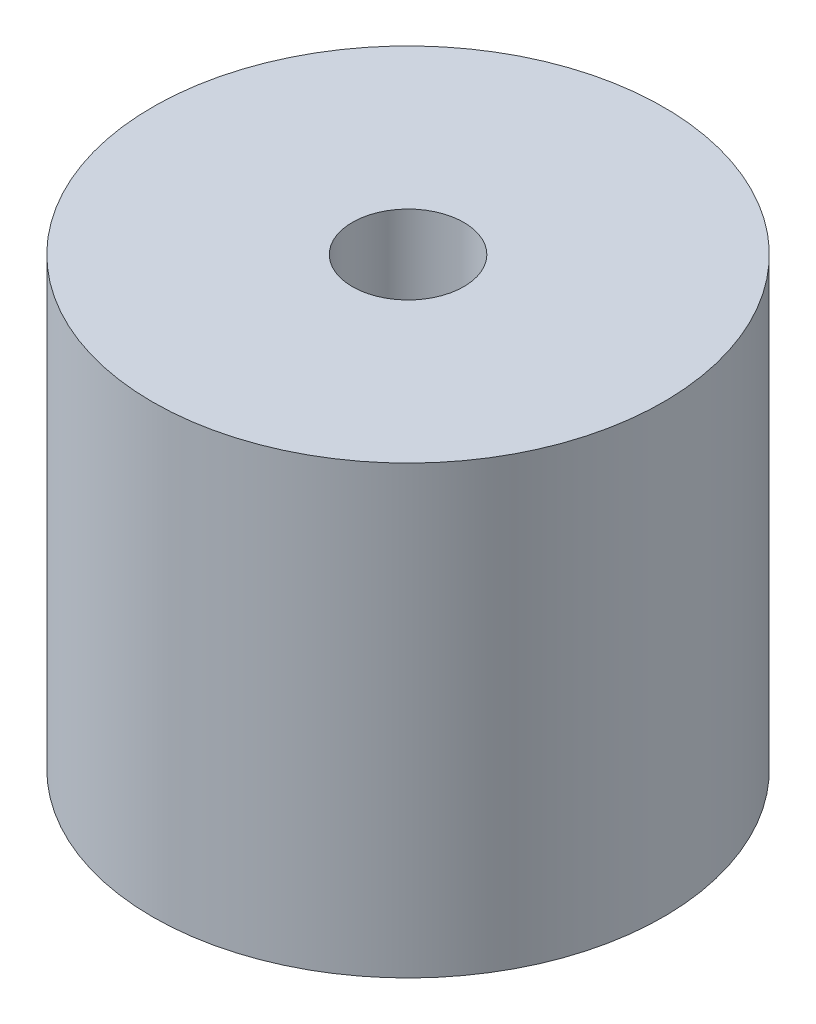
from build123d import *

# Parameters (mm, degrees)
SKETCH_1_R          = 2.75
EXTRUDE_1_DEPTH     = 4.8
SKETCH_2_R          = 0.6
CUT_EXTRUDE_1_DEPTH = 7.177782774


with BuildPart() as part:
    # 草图1 → 凸台-拉伸1 (new body)
    with BuildSketch(Plane(origin=(0, 0, 0), x_dir=(1, 0, 0), z_dir=(0, 1, 0))):
        Circle(SKETCH_1_R)
    extrude(amount=EXTRUDE_1_DEPTH)

    # 草图2 → 切除-拉伸1 (cut, through all)
    with BuildSketch(Plane(origin=(0, 4.8, 0), x_dir=(1, 0, 0), z_dir=(0, 1, 0))):
        Circle(SKETCH_2_R)
    extrude(amount=-CUT_EXTRUDE_1_DEPTH, mode=Mode.SUBTRACT)


solid = part.part
